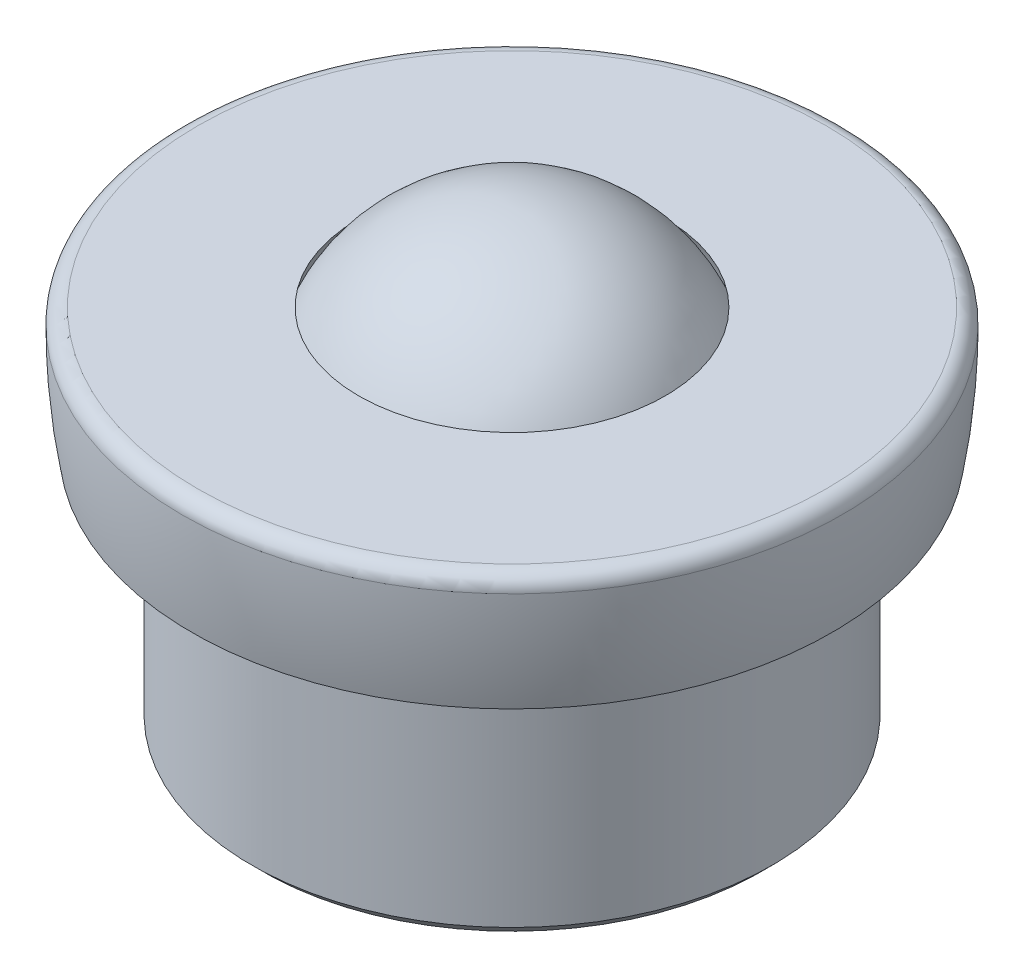
from build123d import *

# Parameters (mm, degrees)
MOVE_FACE1_BY      = 0.127
CHAMFER2_SIZE      = 0.508
CHAMFER1_SIZE      = 0.9525
CUT_SWEEP1_PITCH   = 1.27
CUT_SWEEP1_TO      = 19.05
SKETCH7_R          = 5.08
CUT_EXTRUDE1_DEPTH = 19.05


with BuildPart() as part:
    # Sketch1 → Revolve1 (revolve)
    with BuildSketch(Plane.XY, mode=Mode.PRIVATE) as revolve1_sk:
        with BuildLine():
            Line((0, 3.96875), (14.38671875, 3.96875))
            ThreePointArc((14.38671875, 3.96875), (14.877826507, 3.765326507), (15.08125, 3.27421875))
            ThreePointArc((15.08125, 3.27421875), (14.974710974, 0.834073887), (14.655904724, -1.5875))
            Line((14.655904724, -1.5875), (12.60078125, -1.5875))
            ThreePointArc((12.60078125, -1.5875), (12.109673493, -1.790923493), (11.90625, -2.28203125))
            Line((11.90625, -2.28203125), (11.90625, -12.7))
            Line((11.90625, -12.7), (3.175, -12.7))
            Line((3.175, -12.7), (3.175, -31.75))
            Line((3.175, -31.75), (0, -31.75))
            Line((0, -31.75), (0, 3.96875))
        make_face()
    revolve(revolve1_sk.sketch.rotate(Axis((0, -31.75, 0), (0, 1, 0)), 90), axis=Axis((0, -31.75, 0), (0, 1, 0)))

    # Sketch2 → Cut-Revolve1 (revolve, cut)
    with BuildSketch(Plane.XY):
        with BuildLine():
            Line((0, 7.9375), (0, -7.9375))
            ThreePointArc((0, -7.9375), (7.9375, 0), (0, 7.9375))
        make_face()
    revolve(axis=Axis((0, 7.9375, 0), (0, -1, 0)), mode=Mode.SUBTRACT)

    # Move Face1: a curved face moved inward by 0.127
    add(Solid.thicken(part.faces().sort_by_distance((-6.874076643, -3.96875, 0))[0], -MOVE_FACE1_BY), mode=Mode.SUBTRACT)

    # Chamfer2
    chamfer2_edges = [part.edges().sort_by_distance(p)[0] for p in [
        (0, -12.7, 11.90625),
    ]]
    chamfer(chamfer2_edges, length=CHAMFER2_SIZE)

    # Chamfer1
    chamfer1_edges = [part.edges().sort_by_distance(p)[0] for p in [
        (0, -31.75, 3.175),
    ]]
    chamfer(chamfer1_edges, length=CHAMFER1_SIZE)


with BuildPart() as body_2:
    # Sketch2<2> → Revolve2 (revolve)
    with BuildSketch(Plane.XY):
        with BuildLine():
            Line((0, 7.9375), (0, -7.9375))
            ThreePointArc((0, -7.9375), (7.9375, 0), (0, 7.9375))
        make_face()
    revolve(axis=Axis((0, 7.9375, 0), (0, -1, 0)))


with BuildPart() as body_3:
    # Split1: read off the stored shape, not the designer's step
    # Split1: the piece on the far side of the plane
    add(part.part)
    split(bisect_by=Plane(origin=(0, -12.7, 0), x_dir=(1, 0, 0), z_dir=(0, 1, 0)), keep=Keep.BOTTOM)

    # Cut-Sweep1: arcs per turn and ends read off the stored shape
    # Cut-Sweep1: the profile of Sketch4 profile screwed along a right-hand helix through 16 turns, 8 arcs to a turn; built about Z, then put on its axis
    cut_sweep1_z = Axis((0, 0, 0), (0, 0, 1))
    cut_sweep1_corners = [(3.1753, 0, 0.952673205), (3.1753, 0, -0.158923205), (2.350110803, 0, 0.3175), (2.350110803, 0, 0.47625)]
    with BuildLine(mode=Mode.PRIVATE) as cut_sweep1_profile:
        Line(cut_sweep1_corners[0], cut_sweep1_corners[1])
        Line(cut_sweep1_corners[1], cut_sweep1_corners[2])
        Line(cut_sweep1_corners[2], cut_sweep1_corners[3])
        Line(cut_sweep1_corners[3], cut_sweep1_corners[0])
    cut_sweep1_cap = Face(cut_sweep1_profile.wire())
    cut_sweep1_turn_angles = [0, 22.5, 45, 67.5, 90, 112.5, 135, 157.5, 180, 202.5, 225, 247.5, 270, 292.5, 315, 337.5, 360]
    cut_sweep1_turn_weights = [1, 0.9238795325112867, 1, 0.9238795325112867, 1, 0.9238795325112867, 1, 0.9238795325112867, 1, 0.9238795325112867, 1, 0.9238795325112867, 1, 0.9238795325112867, 1, 0.9238795325112867, 1]
    cut_sweep1_turn_rails = [Edge.make_bspline([Vector(p[0], p[1], 0).rotate(cut_sweep1_z, cut_sweep1_turn_angles[k]) / cut_sweep1_turn_weights[k] + Vector(0, 0, p[2] + CUT_SWEEP1_PITCH * cut_sweep1_turn_angles[k] / 360) for k in range(17)], [0, 0, 0, 1, 1, 2, 2, 3, 3, 4, 4, 5, 5, 6, 6, 7, 7, 8, 8, 8], 2, cut_sweep1_turn_weights) for p in cut_sweep1_corners]
    cut_sweep1_turn_sides = [Face.make_surface_from_curves(cut_sweep1_turn_rails[p[0]], cut_sweep1_turn_rails[p[1]]) for p in [(0, 1), (1, 2), (2, 3), (3, 0)]]
    cut_sweep1 = Plane(origin=(0, -31.75, 0), x_dir=(1, 0, 0), z_dir=(0, 1, 0)) * split(Solid(Shell([*[p.moved(Location((0, 0, CUT_SWEEP1_PITCH * i))) for i in range(16) for p in cut_sweep1_turn_sides], cut_sweep1_cap, cut_sweep1_cap.rotate(cut_sweep1_z, 5760).moved(Location((0, 0, CUT_SWEEP1_PITCH * 5760 / 360)))])), bisect_by=Plane.XY.offset(CUT_SWEEP1_TO), keep=Keep.BOTTOM, mode=Mode.PRIVATE)
    add(cut_sweep1, mode=Mode.SUBTRACT)


with BuildPart() as part_1:
    add(part.part)

    # Split1
    split(bisect_by=Plane(origin=(0, -12.7, 0), x_dir=(1, 0, 0), z_dir=(0, 1, 0)), keep=Keep.TOP)

    add(body_3.part)  # Boss-Extrude1 merges body 3
    # Boss-Extrude1: read off the stored shape, not the designer's step
    # Boss-Extrude1 outline → Boss-Extrude1 (revolve)
    with BuildSketch(Plane.XY):
        Polygon((2.350109772, -12.7), (2.350109772, -14.966367275), (3.175, -12.7), align=None)
    revolve(axis=Axis((0, 0, 0), (0, 1, 0)))

    # Sketch7 → Cut-Extrude1 (cut)
    with BuildSketch(Plane.XZ.offset(31.75)):
        Circle(SKETCH7_R)
    extrude(amount=-CUT_EXTRUDE1_DEPTH, mode=Mode.SUBTRACT)


solid = Compound([body_2.part, part_1.part])
